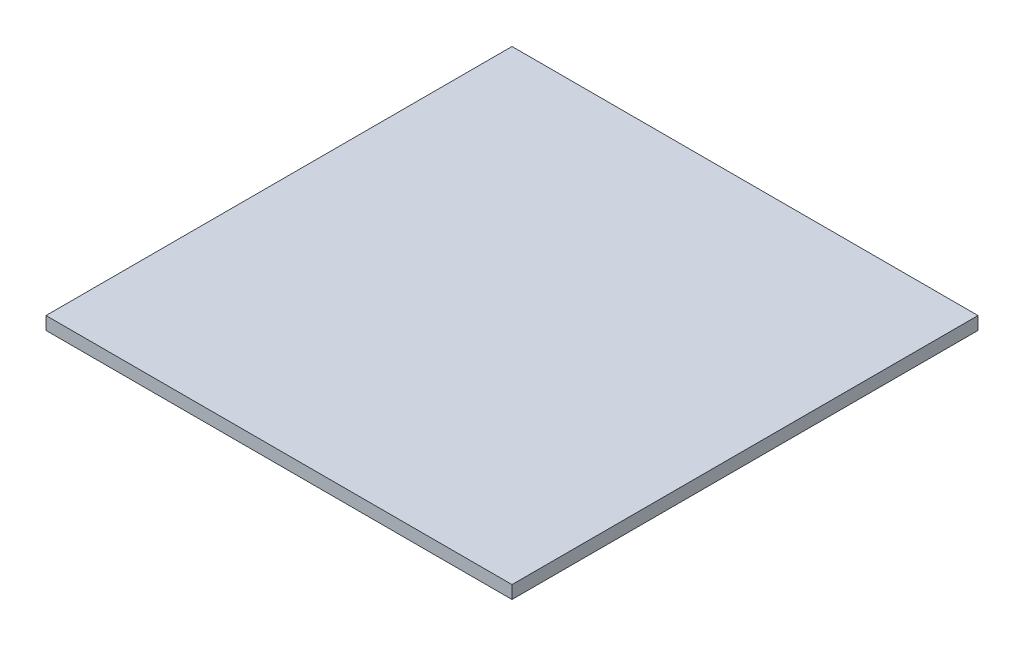
from build123d import *

# Parameters (mm, degrees)
SKETCH2_W           = 180
SKETCH2_H           = 180
BOSS_EXTRUDE1_DEPTH = 5


with BuildPart() as part:
    # Sketch2 → Boss-Extrude1 (new body)
    with BuildSketch(Plane(origin=(0, 0, 0), x_dir=(1, 0, 0), z_dir=(0, 1, 0))):
        Rectangle(SKETCH2_W, SKETCH2_H)
    extrude(amount=BOSS_EXTRUDE1_DEPTH)


solid = part.part
